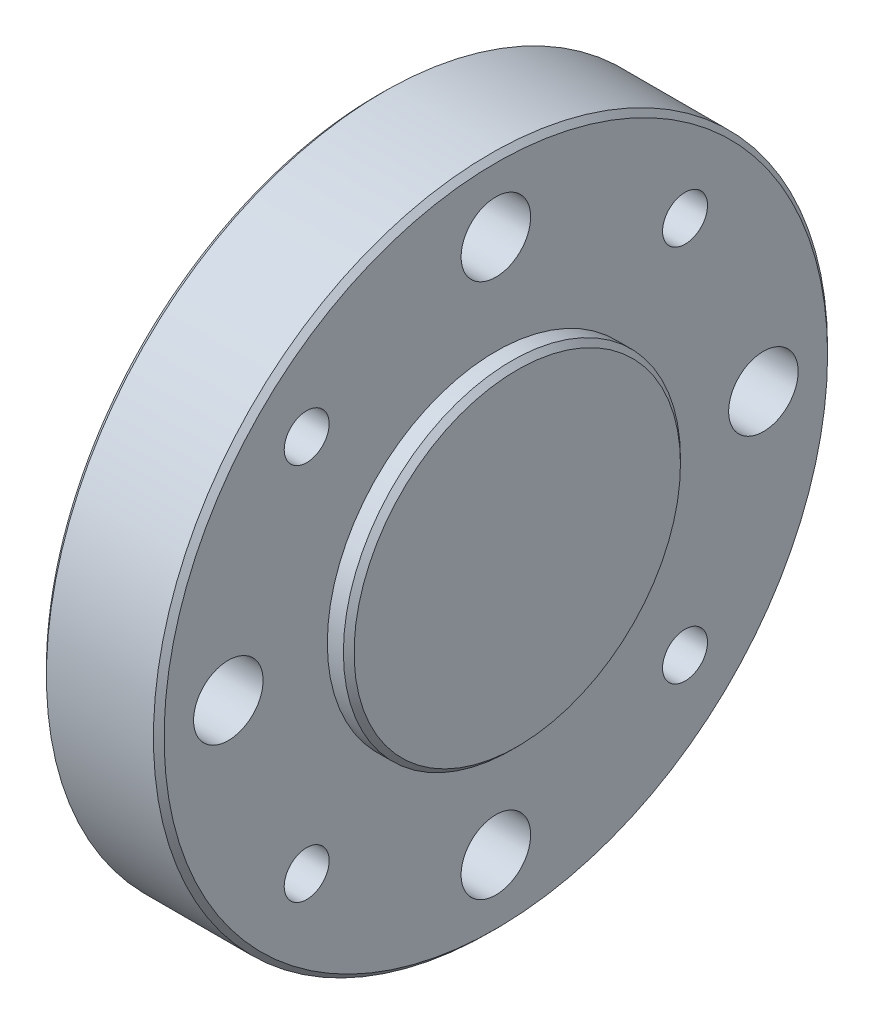
from build123d import *

# Parameters (mm, degrees)
SKETCH1_R           = 31.5
BOSS_EXTRUDE1_DEPTH = 11
SKETCH2_R           = 3.25
CUT_EXTRUDE1_DEPTH  = 46.885727629
SKETCH3_R           = 6
CUT_EXTRUDE2_DEPTH  = 5
CHAMFER1_SIZE       = 0.5
SKETCH4_R           = 15.75
BOSS_EXTRUDE2_DEPTH = 2
CHAMFER2_SIZE       = 0.5
CIRPATTERN1_COUNT   = 4
M5_TAPPED_HOLE1_D   = 4.2


with BuildPart() as part:
    # Sketch1 → Boss-Extrude1 (new body)
    with BuildSketch(Plane(origin=(0, 0, 0), x_dir=(0, 0, -1), z_dir=(1, 0, 0))):
        Circle(SKETCH1_R)
    extrude(amount=BOSS_EXTRUDE1_DEPTH)

    # Sketch2 → Cut-Extrude1 (cut, through all)
    with BuildSketch(Plane.ZY):
        with Locations((0, 25)):
            Circle(SKETCH2_R)
        with Locations((0, -25)):
            Circle(SKETCH2_R)
    cut_extrude1 = extrude(amount=-CUT_EXTRUDE1_DEPTH, mode=Mode.SUBTRACT)

    # Sketch3 → Cut-Extrude2 (cut)
    with BuildSketch(Plane.ZY):
        with Locations((0, 25)):
            Circle(SKETCH3_R)
        with Locations((0, -25)):
            Circle(SKETCH3_R)
    cut_extrude2 = extrude(amount=-CUT_EXTRUDE2_DEPTH, mode=Mode.SUBTRACT)

    # Chamfer1
    chamfer1_edges = [part.edges().sort_by_distance(p)[0] for p in [
        (0, 0, 31.5),
        (11, 0, 31.5),
    ]]
    chamfer(chamfer1_edges, length=CHAMFER1_SIZE - 0.0001)  # a hair under: the kernel refuses the full size

    # Sketch4 → Boss-Extrude2 (add)
    with BuildSketch(Plane(origin=(11, 0, 0), x_dir=(0, 0, -1), z_dir=(1, 0, 0))):
        Circle(SKETCH4_R)
    extrude(amount=BOSS_EXTRUDE2_DEPTH)

    # Chamfer2
    chamfer2_edges = [part.edges().sort_by_distance(p)[0] for p in [
        (13, 0, 15.75),
    ]]
    chamfer(chamfer2_edges, length=CHAMFER2_SIZE)

    # CirPattern1: Cut-Extrude1, Cut-Extrude2 ×4 about axis
    cirpattern1_axis = Axis((0, 0, 0), (1, 0, 0))
    add([cut_extrude1.rotate(cirpattern1_axis, i * 360 / CIRPATTERN1_COUNT) for i in range(1, CIRPATTERN1_COUNT)], mode=Mode.SUBTRACT)
    add([cut_extrude2.rotate(cirpattern1_axis, i * 360 / CIRPATTERN1_COUNT) for i in range(1, CIRPATTERN1_COUNT)], mode=Mode.SUBTRACT)

    # M5 Tapped Hole1 (through all)
    with Locations(Plane(origin=(0, 17.67766953, -17.67766953), x_dir=(0, 0, -1), z_dir=(-1, 0, 0))):
        with Locations((0, 0), (-35.35533906, 0), (0, 35.35533906), (-35.35533906, 35.35533906)):
            Hole(M5_TAPPED_HOLE1_D / 2)


solid = part.part
